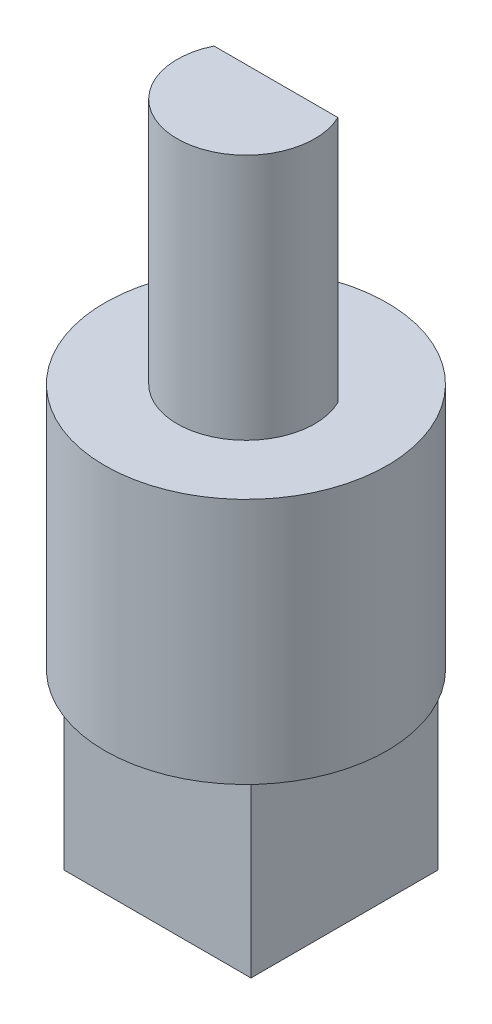
from build123d import *

# Parameters (mm, degrees)
SKETCH1_W           = 5.3
SKETCH1_H           = 5.3
BOSS_EXTRUDE1_DEPTH = 5
SKETCH2_R           = 4
BOSS_EXTRUDE2_DEPTH = 7
SKETCH3_R           = 1.95
BOSS_EXTRUDE3_DEPTH = 7
CUT_EXTRUDE1_START  = -7
CUT_EXTRUDE1_DEPTH  = 7


with BuildPart() as part:
    # Sketch1 → Boss-Extrude1 (new body)
    with BuildSketch(Plane(origin=(0, 0, 0), x_dir=(1, 0, 0), z_dir=(0, 1, 0))):
        with Locations((0, 0.143071786)):
            Rectangle(SKETCH1_W, SKETCH1_H)
    extrude(amount=BOSS_EXTRUDE1_DEPTH)

    # Sketch2 → Boss-Extrude2 (add)
    with BuildSketch(Plane(origin=(0, 5, 0), x_dir=(1, 0, 0), z_dir=(0, 1, 0))):
        Circle(SKETCH2_R)
    extrude(amount=BOSS_EXTRUDE2_DEPTH)

    # Sketch3 → Boss-Extrude3 (add)
    with BuildSketch(Plane(origin=(0, 12, 0), x_dir=(1, 0, 0), z_dir=(0, 1, 0))):
        Circle(SKETCH3_R)
    extrude(amount=BOSS_EXTRUDE3_DEPTH)

    # Sketch4 → Cut-Extrude1 (cut)
    with BuildSketch(Plane(origin=(0, 19, 0), x_dir=(1, 0, 0), z_dir=(0, 1, 0)).offset(CUT_EXTRUDE1_START)):
        with BuildLine():
            Line((-1.754992877, 0.85), (1.754992877, 0.85))
            ThreePointArc((1.754992877, 0.85), (0, 1.95), (-1.754992877, 0.85))
        make_face()
    extrude(amount=CUT_EXTRUDE1_DEPTH, mode=Mode.SUBTRACT)


solid = part.part
